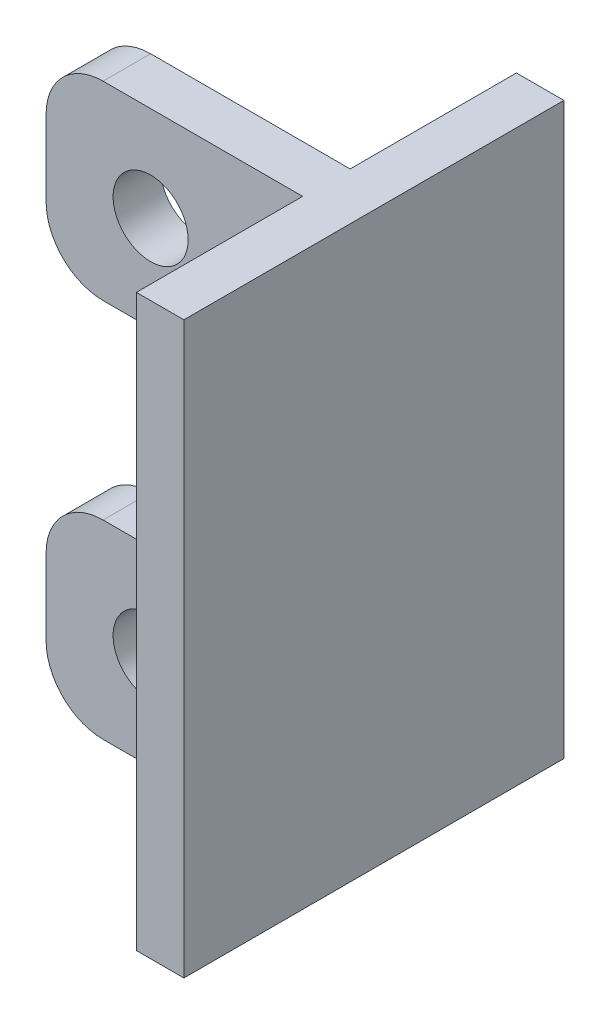
from build123d import *

# Parameters (mm, degrees)
CROQUIS1_R              = 2.50825
SALIENTE_EXTRUIR1_DEPTH = 1.5875
CROQUIS2_W              = 3.175
CROQUIS2_H              = 38.1
SALIENTE_EXTRUIR2_DEPTH = 12.7


with BuildPart() as part:
    # Croquis1 → Saliente-Extruir1 (new, symmetric)
    with BuildSketch(Plane.XY):
        with BuildLine():
            Line((13.335, 19.05), (-3.175, 19.05))
            ThreePointArc((-3.175, 19.05), (-5.869076836, 17.934076836), (-6.985, 15.24))
            Line((-6.985, 15.24), (-6.985, 10.16))
            ThreePointArc((-6.985, 10.16), (-5.869076836, 7.465923164), (-3.175, 6.35))
            Line((-3.175, 6.35), (3.175, 6.35))
            ThreePointArc((3.175, 6.35), (5.869076836, 5.234076836), (6.985, 2.54))
            Line((6.985, 2.54), (6.985, -2.54))
            ThreePointArc((6.985, -2.54), (5.869076836, -5.234076836), (3.175, -6.35))
            Line((3.175, -6.35), (-3.175, -6.35))
            ThreePointArc((-3.175, -6.35), (-5.869076836, -7.465923164), (-6.985, -10.16))
            Line((-6.985, -10.16), (-6.985, -15.24))
            ThreePointArc((-6.985, -15.24), (-5.869076836, -17.934076836), (-3.175, -19.05))
            Line((-3.175, -19.05), (13.335, -19.05))
            Line((13.335, -19.05), (13.335, 19.05))
        make_face()
        with Locations((0, 12.7)):
            Circle(CROQUIS1_R, mode=Mode.SUBTRACT)
        with Locations((0, -12.7)):
            Circle(CROQUIS1_R, mode=Mode.SUBTRACT)
    extrude(amount=SALIENTE_EXTRUIR1_DEPTH, both=True)

    # Croquis2 → Saliente-Extruir2 (add, symmetric)
    with BuildSketch(Plane.XY):
        with Locations((11.7475, 0)):
            Rectangle(CROQUIS2_W, CROQUIS2_H)
    extrude(amount=SALIENTE_EXTRUIR2_DEPTH, both=True)


solid = part.part
